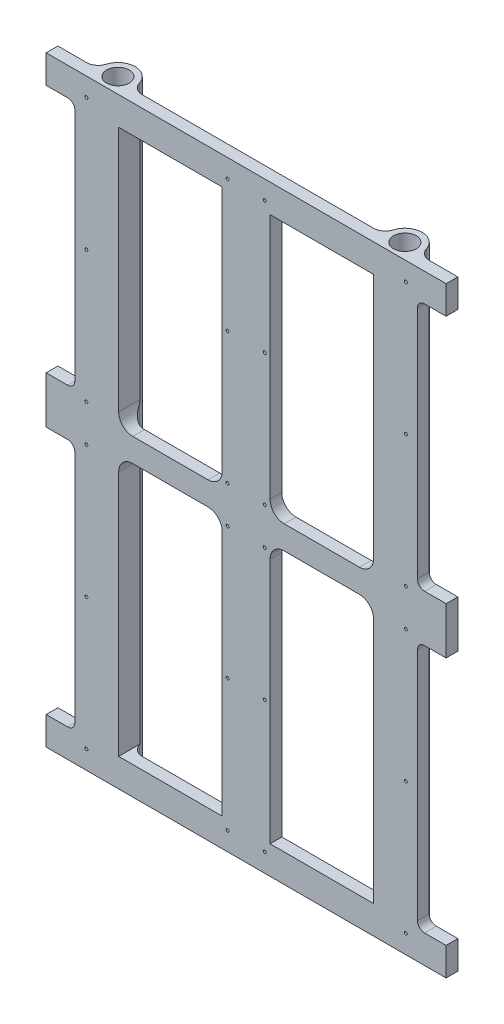
from build123d import *

# Parameters (mm, degrees)
SKETCH1_R                    = 4.825
BOSS_EXTRUDE1_DEPTH          = 255.6
CUT_EXTRUDE2_DEPTH           = 270.507403655
CUT_EXTRUDE2_DEPTH_BACK      = 270.507403655
F_1_25_1_25_DIAMETER_HOLE1_D = 1.25
SKETCH5_R                    = 1.5
CUT_EXTRUDE3_DEPTH           = 270.507403753


with BuildPart() as part:
    # Sketch1 → Boss-Extrude1 (new body)
    with BuildSketch(Plane(origin=(0, 0, 0), x_dir=(1, 0, 0), z_dir=(0, 1, 0))):
        with BuildLine():
            Line((85, -5), (85, 0))
            Line((85, 0), (72.817598106, 0))
            ThreePointArc((72.817598106, 0), (69.825892195, 0.993792849), (68.023440659, 3.580121704))
            ThreePointArc((68.023440659, 3.580121704), (61, 8.825), (53.976559341, 3.580121704))
            ThreePointArc((53.976559341, 3.580121704), (52.174107805, 0.993792849), (49.182401894, 0))
            Line((49.182401894, 0), (-49.182401894, 0))
            ThreePointArc((-49.182401894, 0), (-52.174107805, 0.993792849), (-53.976559341, 3.580121704))
            ThreePointArc((-53.976559341, 3.580121704), (-61, 8.825), (-68.023440659, 3.580121704))
            ThreePointArc((-68.023440659, 3.580121704), (-69.825892195, 0.993792849), (-72.817598106, 0))
            Line((-72.817598106, 0), (-85, 0))
            Line((-85, 0), (-85, -5))
            Line((-85, -5), (85, -5))
        make_face()
        with Locations((-61, 1.5)):
            Circle(SKETCH1_R, mode=Mode.SUBTRACT)
        with Locations((61, 1.5)):
            Circle(SKETCH1_R, mode=Mode.SUBTRACT)
    extrude(amount=BOSS_EXTRUDE1_DEPTH)

    # Sketch2 → Cut-Extrude2 (cut, two sides: drawn at the far end of the back side and taken through both)
    with BuildSketch(Plane(origin=(0, 0, 0), x_dir=(-1, 0, 0), z_dir=(0, 0, -1)).offset(-CUT_EXTRUDE2_DEPTH_BACK)):
        with BuildLine():
            Line((-54.175, 243.6), (-10.175, 243.6))
            Line((-10.175, 243.6), (-10.175, 138.8))
            ThreePointArc((-10.175, 138.8), (-11.932359313, 134.557359313), (-16.175, 132.8))
            Line((-16.175, 132.8), (-48.175, 132.8))
            ThreePointArc((-48.175, 132.8), (-52.417640687, 134.557359313), (-54.175, 138.8))
            Line((-54.175, 138.8), (-54.175, 243.6))
        make_face()
        with BuildLine():
            Line((-87.825, 137.8), (-75.825, 137.8))
            ThreePointArc((-75.825, 137.8), (-73.703679656, 138.678679656), (-72.825, 140.8))
            Line((-72.825, 140.8), (-72.825, 240.6))
            ThreePointArc((-72.825, 240.6), (-73.703679656, 242.721320344), (-75.825, 243.6))
            Line((-75.825, 243.6), (-87.825, 243.6))
            Line((-87.825, 243.6), (-87.825, 137.8))
        make_face()
        with BuildLine():
            Line((-72.825, 114.8), (-72.825, 15))
            ThreePointArc((-72.825, 15), (-73.703679656, 12.878679656), (-75.825, 12))
            Line((-75.825, 12), (-87.825, 12))
            Line((-87.825, 12), (-87.825, 117.8))
            Line((-87.825, 117.8), (-75.825, 117.8))
            ThreePointArc((-75.825, 117.8), (-73.703679656, 116.921320344), (-72.825, 114.8))
        make_face()
        with BuildLine():
            Line((-10.175, 12), (-10.175, 116.8))
            ThreePointArc((-10.175, 116.8), (-11.932359313, 121.042640687), (-16.175, 122.8))
            Line((-16.175, 122.8), (-48.175, 122.8))
            ThreePointArc((-48.175, 122.8), (-52.417640687, 121.042640687), (-54.175, 116.8))
            Line((-54.175, 116.8), (-54.175, 12))
            Line((-54.175, 12), (-10.175, 12))
        make_face()
        with BuildLine():
            Line((54.175, 12), (10.175, 12))
            Line((10.175, 12), (10.175, 116.8))
            ThreePointArc((10.175, 116.8), (11.932359313, 121.042640687), (16.175, 122.8))
            Line((16.175, 122.8), (48.175, 122.8))
            ThreePointArc((48.175, 122.8), (52.417640687, 121.042640687), (54.175, 116.8))
            Line((54.175, 116.8), (54.175, 12))
        make_face()
        with BuildLine():
            Line((87.825, 117.8), (75.825, 117.8))
            ThreePointArc((75.825, 117.8), (73.703679656, 116.921320344), (72.825, 114.8))
            Line((72.825, 114.8), (72.825, 15))
            ThreePointArc((72.825, 15), (73.703679656, 12.878679656), (75.825, 12))
            Line((75.825, 12), (87.825, 12))
            Line((87.825, 12), (87.825, 117.8))
        make_face()
        with BuildLine():
            Line((72.825, 140.8), (72.825, 240.6))
            ThreePointArc((72.825, 240.6), (73.703679656, 242.721320344), (75.825, 243.6))
            Line((75.825, 243.6), (87.825, 243.6))
            Line((87.825, 243.6), (87.825, 137.8))
            Line((87.825, 137.8), (75.825, 137.8))
            ThreePointArc((75.825, 137.8), (73.703679656, 138.678679656), (72.825, 140.8))
        make_face()
        with BuildLine():
            Line((10.175, 243.6), (10.175, 138.8))
            ThreePointArc((10.175, 138.8), (11.932359313, 134.557359313), (16.175, 132.8))
            Line((16.175, 132.8), (48.175, 132.8))
            ThreePointArc((48.175, 132.8), (52.417640687, 134.557359313), (54.175, 138.8))
            Line((54.175, 138.8), (54.175, 243.6))
            Line((54.175, 243.6), (10.175, 243.6))
        make_face()
    extrude(amount=CUT_EXTRUDE2_DEPTH + CUT_EXTRUDE2_DEPTH_BACK, mode=Mode.SUBTRACT)

    # Ø1.25 (1.25) Diameter Hole1 (through all)
    with Locations(Plane(origin=(0, 0, 5), x_dir=(-1, 0, 0), z_dir=(0, 0, 1))):
        with Locations((-67.9, -7.9), (-7.9, -7.9), (-7.9, -63.9), (-67.9, -63.9), (-67.9, -119.9), (-7.9, -119.9), (7.9, -119.9), (67.9, -119.9), (67.9, -63.9), (7.9, -63.9), (7.9, -7.9), (67.9, -7.9), (67.9, -503.3), (7.9, -503.3), (7.9, -447.3), (67.9, -447.3), (67.9, -391.3), (7.9, -391.3), (-7.9, -391.3), (-67.9, -391.3), (-67.9, -447.3), (-7.9, -447.3), (-7.9, -503.3), (-67.9, -503.3), (67.9, -247.7), (7.9, -247.7), (7.9, -191.7), (67.9, -191.7), (67.9, -135.7), (7.9, -135.7), (-7.9, -135.7), (-67.9, -135.7), (-67.9, -191.7), (-7.9, -191.7), (-7.9, -247.7), (-67.9, -247.7)):
            Hole(F_1_25_1_25_DIAMETER_HOLE1_D / 2)

    # Sketch5 → Cut-Extrude3 (cut, through all)
    with BuildSketch(Plane(origin=(0, 0, 0), x_dir=(-1, 0, 0), z_dir=(0, 0, -1))):
        with Locations((-67.9, 247.7)):
            Circle(SKETCH5_R)
        with Locations((-7.9, 247.7)):
            Circle(SKETCH5_R)
        with Locations((-67.9, 191.7)):
            Circle(SKETCH5_R)
        with Locations((-67.9, 135.7)):
            Circle(SKETCH5_R)
        with Locations((-7.9, 135.7)):
            Circle(SKETCH5_R)
        with Locations((-7.9, 191.7)):
            Circle(SKETCH5_R)
        with Locations((7.9, 191.7)):
            Circle(SKETCH5_R)
        with Locations((7.9, 135.7)):
            Circle(SKETCH5_R)
        with Locations((67.9, 135.7)):
            Circle(SKETCH5_R)
        with Locations((67.9, 191.7)):
            Circle(SKETCH5_R)
        with Locations((7.9, 247.7)):
            Circle(SKETCH5_R)
        with Locations((67.9, 247.7)):
            Circle(SKETCH5_R)
        with Locations((67.9, 7.9)):
            Circle(SKETCH5_R)
        with Locations((7.9, 7.9)):
            Circle(SKETCH5_R)
        with Locations((67.9, 63.9)):
            Circle(SKETCH5_R)
        with Locations((67.9, 119.9)):
            Circle(SKETCH5_R)
        with Locations((7.9, 119.9)):
            Circle(SKETCH5_R)
        with Locations((7.9, 63.9)):
            Circle(SKETCH5_R)
        with Locations((-7.9, 63.9)):
            Circle(SKETCH5_R)
        with Locations((-7.9, 119.9)):
            Circle(SKETCH5_R)
        with Locations((-67.9, 119.9)):
            Circle(SKETCH5_R)
        with Locations((-67.9, 63.9)):
            Circle(SKETCH5_R)
        with Locations((-7.9, 7.9)):
            Circle(SKETCH5_R)
        with Locations((-67.9, 7.9)):
            Circle(SKETCH5_R)
    extrude(amount=CUT_EXTRUDE3_DEPTH, mode=Mode.SUBTRACT)


solid = part.part
